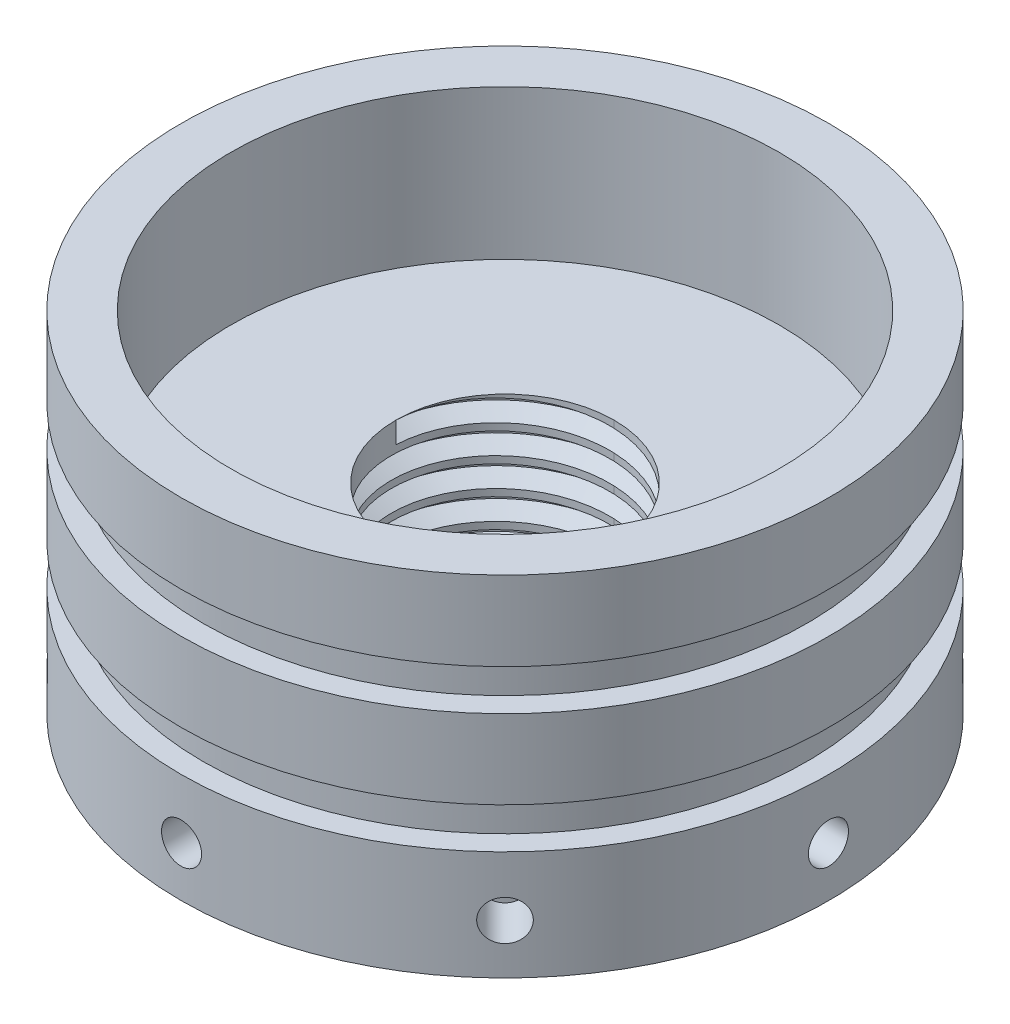
from build123d import *

# Parameters (mm, degrees)
F_1_4_20_TAPPED_HOLE1_REACH  = 101.849
F_1_4_20_TAPPED_HOLE1_BORE_R = 2.5527
CIRPATTERN1_COUNT            = 8
THREAD1_PITCH                = 3.628571429
SKETCH10_W                   = 2.9083
SKETCH10_H                   = 5.187687888
LPATTERN1_COUNT              = 2
LPATTERN1_PITCH              = 15.24


with BuildPart() as part:
    # Sketch1 → Revolve1 (revolve)
    with BuildSketch(Plane.XY, mode=Mode.PRIVATE) as revolve1_sk:
        Polygon((-41.275, -44.45), (-41.275, 0), (-34.925, 0), (-34.925, -19.05), (-13.91158, -19.05), (-13.91158, -39.37), (-8.90651, -39.37), (-8.90651, -52.832), (-20.32, -52.832), (-20.32, -31.75), (-34.925, -31.75), (-34.925, -44.45), align=None)
    revolve(revolve1_sk.sketch.rotate(Axis((0, 0, 0), (0, 1, 0)), 270), axis=Axis((0, 0, 0), (0, 1, 0)))

    # 1/4-20 Tapped Hole1 bore (on position points) → 1/4-20 Tapped Hole1 (cut, up to next)
    with BuildSketch(Plane(origin=(41.275, -38.1, 0), x_dir=(0, 0, 1), z_dir=(1, 0, 0)), mode=Mode.PRIVATE) as f_1_4_20_tapped_hole1_sk1:
        Circle(F_1_4_20_TAPPED_HOLE1_BORE_R)
    f_1_4_20_tapped_hole1_tool1 = extrude(f_1_4_20_tapped_hole1_sk1.sketch, amount=-F_1_4_20_TAPPED_HOLE1_REACH, mode=Mode.PRIVATE) & part.part
    f_1_4_20_tapped_hole1 = f_1_4_20_tapped_hole1_tool1.solids().sort_by_distance((41.275, -38.1, 0))[0]
    add(f_1_4_20_tapped_hole1, mode=Mode.SUBTRACT)

    # CirPattern1: 1/4-20 Tapped Hole1 ×8 about axis
    cirpattern1_axis = Axis((0, -65.053701407, 0), (0, 1, 0))
    for i in range(1, CIRPATTERN1_COUNT):
        add(f_1_4_20_tapped_hole1.rotate(cirpattern1_axis, i * 360 / CIRPATTERN1_COUNT), mode=Mode.SUBTRACT)

    # Thread1: the profile of Thread Profile1 profile screwed along a right-hand helix of 4.2 turns, 12 arcs to a turn; built about Z, then put on its axis
    thread1_z = Axis((0, 0, 0), (0, 0, 1))
    thread1_corners = [(13.91128, 0, -0.000173205), (15.875601889, 0, 1.133928566), (15.875601889, 0, 1.587499995), (13.91128, 0, 2.721601767)]
    with BuildLine(mode=Mode.PRIVATE) as thread1_profile:
        Line(thread1_corners[0], thread1_corners[1])
        Line(thread1_corners[1], thread1_corners[2])
        Line(thread1_corners[2], thread1_corners[3])
        Line(thread1_corners[3], thread1_corners[0])
    thread1_cap = Face(thread1_profile.wire())
    thread1_turn_angles = [0, 15, 30, 45, 60, 75, 90, 105, 120, 135, 150, 165, 180, 195, 210, 225, 240, 255, 270, 285, 300, 315, 330, 345, 360]
    thread1_turn_weights = [1, 0.9659258262890683, 1, 0.9659258262890683, 1, 0.9659258262890683, 1, 0.9659258262890683, 1, 0.9659258262890683, 1, 0.9659258262890683, 1, 0.9659258262890683, 1, 0.9659258262890683, 1, 0.9659258262890683, 1, 0.9659258262890683, 1, 0.9659258262890683, 1, 0.9659258262890683, 1]
    thread1_turn_rails = [Edge.make_bspline([Vector(p[0], p[1], 0).rotate(thread1_z, thread1_turn_angles[k]) / thread1_turn_weights[k] + Vector(0, 0, p[2] + THREAD1_PITCH * thread1_turn_angles[k] / 360) for k in range(25)], [0, 0, 0, 1, 1, 2, 2, 3, 3, 4, 4, 5, 5, 6, 6, 7, 7, 8, 8, 9, 9, 10, 10, 11, 11, 12, 12, 12], 2, thread1_turn_weights) for p in thread1_corners]
    thread1_turn_sides = [Face.make_surface_from_curves(thread1_turn_rails[p[0]], thread1_turn_rails[p[1]]) for p in [(0, 1), (1, 2), (2, 3), (3, 0)]]
    thread1_last_angles = [1440, 1455, 1470, 1485, 1500, 1506, 1512]
    thread1_last_weights = [1, 0.9659258262890683, 1, 0.9659258262890683, 1, 0.9945218953682737, 1]
    thread1_last_rails = [Edge.make_bspline([Vector(p[0], p[1], 0).rotate(thread1_z, thread1_last_angles[k]) / thread1_last_weights[k] + Vector(0, 0, p[2] + THREAD1_PITCH * thread1_last_angles[k] / 360) for k in range(7)], [0, 0, 0, 1, 1, 2, 2, 3, 3, 3], 2, thread1_last_weights) for p in thread1_corners]
    thread1_last_sides = [Face.make_surface_from_curves(thread1_last_rails[p[0]], thread1_last_rails[p[1]]) for p in [(0, 1), (1, 2), (2, 3), (3, 0)]]
    thread1 = Plane(origin=(0, -19.05, 0), x_dir=(-1, 0, 0), z_dir=(0, -1, 0)) * Solid(Shell([*[p.moved(Location((0, 0, THREAD1_PITCH * i))) for i in range(4) for p in thread1_turn_sides], *thread1_last_sides, thread1_cap, thread1_cap.rotate(thread1_z, 1512).moved(Location((0, 0, THREAD1_PITCH * 1512 / 360)))]))
    add(thread1, mode=Mode.SUBTRACT)

    # Sketch10 → Groove for AS 568-234, O-Ring1 (revolve, cut)
    with BuildSketch(Plane(origin=(0, 0, 0), x_dir=(0, 0, -1), z_dir=(-1, 0, 0))):
        with Locations((39.907624767, 12.7)):
            Rectangle(SKETCH10_W, SKETCH10_H)
    groove_for_as_568_234_o_ring1 = revolve(axis=Axis((0, -50, 0), (0, 1, 0)), mode=Mode.SUBTRACT)

    # LPattern1: Groove for AS 568-234, O-Ring1 ×2
    with Locations(*[(0, -i * LPATTERN1_PITCH, 0) for i in range(1, LPATTERN1_COUNT)]):
        add(groove_for_as_568_234_o_ring1, mode=Mode.SUBTRACT)


solid = part.part
